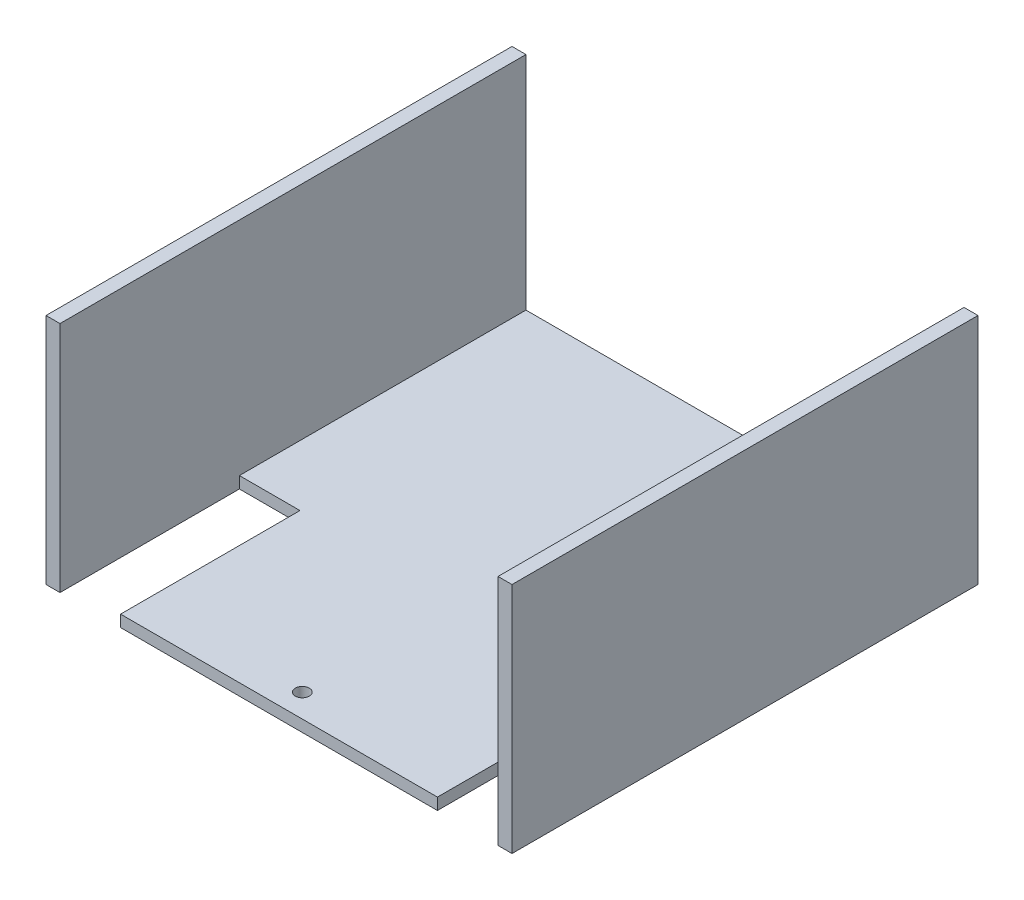
from build123d import *

# Parameters (mm, degrees)
SALIENTE_EXTRUIR1_DEPTH = 100
CROQUIS2_W              = 13
CROQUIS2_H              = 38.5
CORTAR_EXTRUIR2_DEPTH   = 10
CROQUIS3_R              = 1.5
CORTAR_EXTRUIR3_DEPTH   = 5


with BuildPart() as part:
    # Croquis1 → Saliente-Extruir1 (new body)
    with BuildSketch(Plane.XY):
        Polygon((50, 0), (-50, 0), (-50, 50), (-47, 50), (-47, 2.5), (47, 2.5), (47, 50), (50, 50), align=None)
    extrude(amount=-SALIENTE_EXTRUIR1_DEPTH)

    # Croquis2 → Cortar-Extruir2 (cut)
    with BuildSketch(Plane(origin=(0, 2.5, 0), x_dir=(1, 0, 0), z_dir=(0, 1, 0))):
        with Locations((-40.5, 19.25)):
            Rectangle(CROQUIS2_W, CROQUIS2_H)
        with Locations((40.5, 19.25)):
            Rectangle(CROQUIS2_W, CROQUIS2_H)
    extrude(amount=-CORTAR_EXTRUIR2_DEPTH, mode=Mode.SUBTRACT)

    # Croquis3 → Cortar-Extruir3 (cut)
    with BuildSketch(Plane(origin=(0, 2.5, 0), x_dir=(1, 0, 0), z_dir=(0, 1, 0))):
        with Locations((0, 5)):
            Circle(CROQUIS3_R)
    extrude(amount=-CORTAR_EXTRUIR3_DEPTH, mode=Mode.SUBTRACT)


solid = part.part
